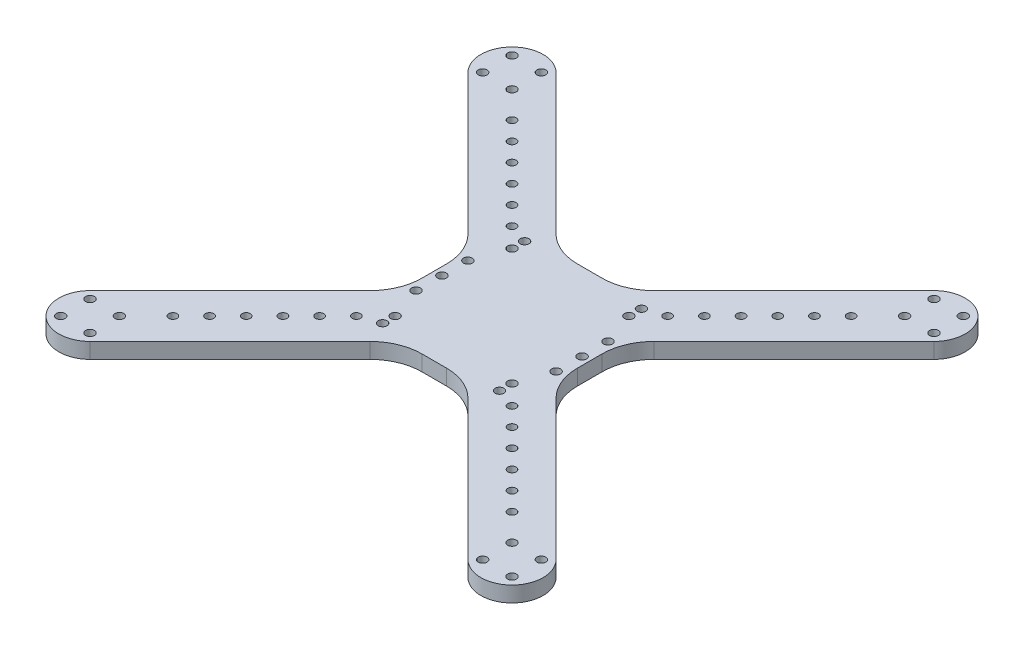
from build123d import *

# Parameters (mm, degrees)
BOSS_EXTRUDE1_DEPTH          = 6
FILLET1_R                    = 20
SKETCH2_R                    = 1.7
CUT_EXTRUDE1_DEPTH           = 133.106886392
CIRPATTERN1_COUNT            = 4
SKETCH3_R                    = 1.6
CUT_EXTRUDE2_DEPTH           = 133.106886392
LPATTERN1_COUNT              = 6
LPATTERN1_PITCH              = 10
CIRPATTERN2_COPY_1_SKETCH_R  = 1.6
CIRPATTERN2_COPY_1_DEPTH     = 133.106886392
CIRPATTERN2_COPY_2_SKETCH_R  = 1.6
CIRPATTERN2_COPY_2_DEPTH     = 133.106886392
CIRPATTERN2_COPY_3_SKETCH_R  = 1.6
CIRPATTERN2_COPY_3_DEPTH     = 133.106886392
CIRPATTERN2_COPY_4_SKETCH_R  = 1.6
CIRPATTERN2_COPY_4_DEPTH     = 133.106886392
CIRPATTERN2_COPY_5_SKETCH_R  = 1.6
CIRPATTERN2_COPY_5_DEPTH     = 133.106886392
CIRPATTERN2_COPY_6_SKETCH_R  = 1.6
CIRPATTERN2_COPY_6_DEPTH     = 133.106886392
CIRPATTERN2_COPY_7_SKETCH_R  = 1.6
CIRPATTERN2_COPY_7_DEPTH     = 133.106886392
CIRPATTERN2_COPY_8_SKETCH_R  = 1.6
CIRPATTERN2_COPY_8_DEPTH     = 133.106886392
CIRPATTERN2_COPY_9_SKETCH_R  = 1.6
CIRPATTERN2_COPY_9_DEPTH     = 133.106886392
CIRPATTERN2_COPY_10_SKETCH_R = 1.6
CIRPATTERN2_COPY_10_DEPTH    = 133.106886392
CIRPATTERN2_COPY_11_SKETCH_R = 1.6
CIRPATTERN2_COPY_11_DEPTH    = 133.106886392
CIRPATTERN2_COPY_12_SKETCH_R = 1.6
CIRPATTERN2_COPY_12_DEPTH    = 133.106886392
CIRPATTERN2_COPY_13_SKETCH_R = 1.6
CIRPATTERN2_COPY_13_DEPTH    = 133.106886392
CIRPATTERN2_COPY_14_SKETCH_R = 1.6
CIRPATTERN2_COPY_14_DEPTH    = 133.106886392
CIRPATTERN2_COPY_15_SKETCH_R = 1.6
CIRPATTERN2_COPY_15_DEPTH    = 133.106886392
CIRPATTERN2_COPY_16_SKETCH_R = 1.6
CIRPATTERN2_COPY_16_DEPTH    = 133.106886392
CIRPATTERN2_COPY_17_SKETCH_R = 1.6
CIRPATTERN2_COPY_17_DEPTH    = 133.106886392
CIRPATTERN2_COPY_18_SKETCH_R = 1.6
CIRPATTERN2_COPY_18_DEPTH    = 133.106886392
SKETCH4_R                    = 1.7
CUT_EXTRUDE3_DEPTH           = 133.106886392
CIRPATTERN3_COUNT            = 4
SKETCH5_R                    = 1.7
CUT_EXTRUDE4_DEPTH           = 133.106886392
SKETCH7_R                    = 1.7
CUT_EXTRUDE5_DEPTH           = 133.106886392
LPATTERN2_COUNT              = 2
LPATTERN2_PITCH              = 10
LPATTERN2_COUNT_DIR2         = 2
LPATTERN2_PITCH_DIR2         = 10
MIRROR2_COPY_1_SKETCH_R      = 1.7
MIRROR2_COPY_1_DEPTH         = 133.106886392
MIRROR2_COPY_2_SKETCH_R      = 1.7
MIRROR2_COPY_2_DEPTH         = 133.106886392
MIRROR2_COPY_3_SKETCH_R      = 1.7
MIRROR2_COPY_3_DEPTH         = 133.106886392
MIRROR2_COPY_4_SKETCH_R      = 1.7
MIRROR2_COPY_4_DEPTH         = 133.106886392


with BuildPart() as part:
    # Sketch1 → Boss-Extrude1 (new body)
    with BuildSketch(Plane(origin=(0, 0, 0), x_dir=(1, 0, 0), z_dir=(0, 1, 0))):
        with BuildLine():
            Line((-72.831998462, 89.802561211), (-13.029437252, 30))
            Line((-13.029437252, 30), (13.029437252, 30))
            Line((13.029437252, 30), (72.831998462, 89.802561211))
            ThreePointArc((72.831998462, 89.802561211), (89.802561211, 89.802561211), (89.802561211, 72.831998462))
            Line((89.802561211, 72.831998462), (30, 13.029437252))
            Line((30, 13.029437252), (30, -13.029437252))
            Line((30, -13.029437252), (89.802561211, -72.831998462))
            ThreePointArc((89.802561211, -72.831998462), (89.802561211, -89.802561211), (72.831998462, -89.802561211))
            Line((72.831998462, -89.802561211), (13.029437252, -30))
            Line((13.029437252, -30), (-13.029437252, -30))
            Line((-13.029437252, -30), (-72.831998462, -89.802561211))
            ThreePointArc((-72.831998462, -89.802561211), (-89.802561211, -89.802561211), (-89.802561211, -72.831998462))
            Line((-89.802561211, -72.831998462), (-30, -13.029437252))
            Line((-30, -13.029437252), (-30, 13.029437252))
            Line((-30, 13.029437252), (-89.802561211, 72.831998462))
            ThreePointArc((-89.802561211, 72.831998462), (-89.802561211, 89.802561211), (-72.831998462, 89.802561211))
        make_face()
    extrude(amount=BOSS_EXTRUDE1_DEPTH)

    # Fillet1
    fillet1_edges = [part.edges().sort_by_distance(p)[0] for p in [
        (-30, 3, -13.029437252),
        (-30, 3, 13.029437252),
        (-13.029437252, 3, -30),
        (13.029437252, 3, -30),
        (30, 3, 13.029437252),
        (30, 3, -13.029437252),
        (13.029437252, 3, 30),
        (-13.029437252, 3, 30),
    ]]
    fillet(fillet1_edges, radius=FILLET1_R)

    # Sketch2 → Cut-Extrude1 (cut, through all)
    with BuildSketch(Plane(origin=(0, 6, 0), x_dir=(1, 0, 0), z_dir=(0, 1, 0))):
        with Locations((-22.525, -22.525)):
            Circle(SKETCH2_R)
    cut_extrude1 = extrude(amount=-CUT_EXTRUDE1_DEPTH, mode=Mode.SUBTRACT)

    # CirPattern1: Cut-Extrude1 ×4 about axis
    cirpattern1_axis = Axis((0, 6.3, 0), (0, -1, 0))
    for i in range(1, CIRPATTERN1_COUNT):
        add(cut_extrude1.rotate(cirpattern1_axis, i * 360 / CIRPATTERN1_COUNT), mode=Mode.SUBTRACT)

    # Sketch3 → Cut-Extrude2 (cut, through all)
    with BuildSketch(Plane(origin=(0, 6, 0), x_dir=(1, 0, 0), z_dir=(0, 1, 0))):
        with Locations((-30, -30)):
            Circle(SKETCH3_R)
    cut_extrude2 = extrude(amount=-CUT_EXTRUDE2_DEPTH, mode=Mode.SUBTRACT)

    # LPattern1: Cut-Extrude2 ×6
    with Locations(*[Vector(-0.7071067811865466, 0, 0.7071067811865485) * (i * LPATTERN1_PITCH) for i in range(1, LPATTERN1_COUNT)]):
        add(cut_extrude2, mode=Mode.SUBTRACT)

    # CirPattern2 copy 1 sketch → CirPattern2 copy 1 (cut, through all)
    with BuildSketch(Plane(origin=(-7.071067812, 6, -7.071067812), x_dir=(0, 0, 1), z_dir=(0, 1, 0))):
        with Locations((-30, -30)):
            Circle(CIRPATTERN2_COPY_1_SKETCH_R)
    extrude(amount=-CIRPATTERN2_COPY_1_DEPTH, mode=Mode.SUBTRACT)

    # CirPattern2 copy 2 sketch → CirPattern2 copy 2 (cut, through all)
    with BuildSketch(Plane(origin=(7.071067812, 6, -7.071067812), x_dir=(-1, 0, 0), z_dir=(0, 1, 0))):
        with Locations((-30, -30)):
            Circle(CIRPATTERN2_COPY_2_SKETCH_R)
    extrude(amount=-CIRPATTERN2_COPY_2_DEPTH, mode=Mode.SUBTRACT)

    # CirPattern2 copy 3 sketch → CirPattern2 copy 3 (cut, through all)
    with BuildSketch(Plane(origin=(7.071067812, 6, 7.071067812), x_dir=(0, 0, -1), z_dir=(0, 1, 0))):
        with Locations((-30, -30)):
            Circle(CIRPATTERN2_COPY_3_SKETCH_R)
    extrude(amount=-CIRPATTERN2_COPY_3_DEPTH, mode=Mode.SUBTRACT)

    # CirPattern2 copy 4 sketch → CirPattern2 copy 4 (cut, through all)
    with BuildSketch(Plane(origin=(-14.142135624, 6, -14.142135624), x_dir=(0, 0, 1), z_dir=(0, 1, 0))):
        with Locations((-30, -30)):
            Circle(CIRPATTERN2_COPY_4_SKETCH_R)
    extrude(amount=-CIRPATTERN2_COPY_4_DEPTH, mode=Mode.SUBTRACT)

    # CirPattern2 copy 5 sketch → CirPattern2 copy 5 (cut, through all)
    with BuildSketch(Plane(origin=(14.142135624, 6, -14.142135624), x_dir=(-1, 0, 0), z_dir=(0, 1, 0))):
        with Locations((-30, -30)):
            Circle(CIRPATTERN2_COPY_5_SKETCH_R)
    extrude(amount=-CIRPATTERN2_COPY_5_DEPTH, mode=Mode.SUBTRACT)

    # CirPattern2 copy 6 sketch → CirPattern2 copy 6 (cut, through all)
    with BuildSketch(Plane(origin=(14.142135624, 6, 14.142135624), x_dir=(0, 0, -1), z_dir=(0, 1, 0))):
        with Locations((-30, -30)):
            Circle(CIRPATTERN2_COPY_6_SKETCH_R)
    extrude(amount=-CIRPATTERN2_COPY_6_DEPTH, mode=Mode.SUBTRACT)

    # CirPattern2 copy 7 sketch → CirPattern2 copy 7 (cut, through all)
    with BuildSketch(Plane(origin=(-21.213203436, 6, -21.213203436), x_dir=(0, 0, 1), z_dir=(0, 1, 0))):
        with Locations((-30, -30)):
            Circle(CIRPATTERN2_COPY_7_SKETCH_R)
    extrude(amount=-CIRPATTERN2_COPY_7_DEPTH, mode=Mode.SUBTRACT)

    # CirPattern2 copy 8 sketch → CirPattern2 copy 8 (cut, through all)
    with BuildSketch(Plane(origin=(21.213203436, 6, -21.213203436), x_dir=(-1, 0, 0), z_dir=(0, 1, 0))):
        with Locations((-30, -30)):
            Circle(CIRPATTERN2_COPY_8_SKETCH_R)
    extrude(amount=-CIRPATTERN2_COPY_8_DEPTH, mode=Mode.SUBTRACT)

    # CirPattern2 copy 9 sketch → CirPattern2 copy 9 (cut, through all)
    with BuildSketch(Plane(origin=(21.213203436, 6, 21.213203436), x_dir=(0, 0, -1), z_dir=(0, 1, 0))):
        with Locations((-30, -30)):
            Circle(CIRPATTERN2_COPY_9_SKETCH_R)
    extrude(amount=-CIRPATTERN2_COPY_9_DEPTH, mode=Mode.SUBTRACT)

    # CirPattern2 copy 10 sketch → CirPattern2 copy 10 (cut, through all)
    with BuildSketch(Plane(origin=(-28.284271247, 6, -28.284271247), x_dir=(0, 0, 1), z_dir=(0, 1, 0))):
        with Locations((-30, -30)):
            Circle(CIRPATTERN2_COPY_10_SKETCH_R)
    extrude(amount=-CIRPATTERN2_COPY_10_DEPTH, mode=Mode.SUBTRACT)

    # CirPattern2 copy 11 sketch → CirPattern2 copy 11 (cut, through all)
    with BuildSketch(Plane(origin=(28.284271247, 6, -28.284271247), x_dir=(-1, 0, 0), z_dir=(0, 1, 0))):
        with Locations((-30, -30)):
            Circle(CIRPATTERN2_COPY_11_SKETCH_R)
    extrude(amount=-CIRPATTERN2_COPY_11_DEPTH, mode=Mode.SUBTRACT)

    # CirPattern2 copy 12 sketch → CirPattern2 copy 12 (cut, through all)
    with BuildSketch(Plane(origin=(28.284271247, 6, 28.284271247), x_dir=(0, 0, -1), z_dir=(0, 1, 0))):
        with Locations((-30, -30)):
            Circle(CIRPATTERN2_COPY_12_SKETCH_R)
    extrude(amount=-CIRPATTERN2_COPY_12_DEPTH, mode=Mode.SUBTRACT)

    # CirPattern2 copy 13 sketch → CirPattern2 copy 13 (cut, through all)
    with BuildSketch(Plane(origin=(-35.355339059, 6, -35.355339059), x_dir=(0, 0, 1), z_dir=(0, 1, 0))):
        with Locations((-30, -30)):
            Circle(CIRPATTERN2_COPY_13_SKETCH_R)
    extrude(amount=-CIRPATTERN2_COPY_13_DEPTH, mode=Mode.SUBTRACT)

    # CirPattern2 copy 14 sketch → CirPattern2 copy 14 (cut, through all)
    with BuildSketch(Plane(origin=(35.355339059, 6, -35.355339059), x_dir=(-1, 0, 0), z_dir=(0, 1, 0))):
        with Locations((-30, -30)):
            Circle(CIRPATTERN2_COPY_14_SKETCH_R)
    extrude(amount=-CIRPATTERN2_COPY_14_DEPTH, mode=Mode.SUBTRACT)

    # CirPattern2 copy 15 sketch → CirPattern2 copy 15 (cut, through all)
    with BuildSketch(Plane(origin=(35.355339059, 6, 35.355339059), x_dir=(0, 0, -1), z_dir=(0, 1, 0))):
        with Locations((-30, -30)):
            Circle(CIRPATTERN2_COPY_15_SKETCH_R)
    extrude(amount=-CIRPATTERN2_COPY_15_DEPTH, mode=Mode.SUBTRACT)

    # CirPattern2 copy 16 sketch → CirPattern2 copy 16 (cut, through all)
    with BuildSketch(Plane.ZX.offset(6)):
        with Locations((-30, -30)):
            Circle(CIRPATTERN2_COPY_16_SKETCH_R)
    extrude(amount=-CIRPATTERN2_COPY_16_DEPTH, mode=Mode.SUBTRACT)

    # CirPattern2 copy 17 sketch → CirPattern2 copy 17 (cut, through all)
    with BuildSketch(Plane(origin=(0, 6, 0), x_dir=(-1, 0, 0), z_dir=(0, 1, 0))):
        with Locations((-30, -30)):
            Circle(CIRPATTERN2_COPY_17_SKETCH_R)
    extrude(amount=-CIRPATTERN2_COPY_17_DEPTH, mode=Mode.SUBTRACT)

    # CirPattern2 copy 18 sketch → CirPattern2 copy 18 (cut, through all)
    with BuildSketch(Plane(origin=(0, 6, 0), x_dir=(0, 0, -1), z_dir=(0, 1, 0))):
        with Locations((-30, -30)):
            Circle(CIRPATTERN2_COPY_18_SKETCH_R)
    extrude(amount=-CIRPATTERN2_COPY_18_DEPTH, mode=Mode.SUBTRACT)

    # Sketch4 → Cut-Extrude3 (cut, through all)
    with BuildSketch(Plane(origin=(0, 6, 0), x_dir=(1, 0, 0), z_dir=(0, 1, 0))):
        with Locations((-75.660425587, -75.660425587)):
            Circle(SKETCH4_R)
        with Locations((-75.660425587, -86.974134086)):
            Circle(SKETCH4_R)
        with Locations((-86.974134086, -75.660425587)):
            Circle(SKETCH4_R)
        with Locations((-86.974134086, -86.974134086)):
            Circle(SKETCH4_R)
    cut_extrude3 = extrude(amount=-CUT_EXTRUDE3_DEPTH, mode=Mode.SUBTRACT)

    # CirPattern3: Cut-Extrude3 ×4 about axis
    cirpattern3_axis = Axis((0, 6.3, 0), (0, -1, 0))
    for i in range(1, CIRPATTERN3_COUNT):
        add(cut_extrude3.rotate(cirpattern3_axis, i * 360 / CIRPATTERN3_COUNT), mode=Mode.SUBTRACT)

    # Sketch5 → Cut-Extrude4 (cut, through all)
    with BuildSketch(Plane(origin=(0, 6, 0), x_dir=(1, 0, 0), z_dir=(0, 1, 0))):
        with Locations((-22.525, 27.375)):
            Circle(SKETCH5_R)
        with Locations((-22.525, -27.35)):
            Circle(SKETCH5_R)
    cut_extrude4 = extrude(amount=-CUT_EXTRUDE4_DEPTH, mode=Mode.SUBTRACT)

    # Mirror1: Cut-Extrude4 across plane
    add(cut_extrude4.mirror(Plane(origin=(0, 0, 0), x_dir=(0, 0, 1), z_dir=(1, 0, 0))), mode=Mode.SUBTRACT)

    # Sketch7 → Cut-Extrude5 (cut, through all)
    with BuildSketch(Plane(origin=(0, 6, 0), x_dir=(1, 0, 0), z_dir=(0, 1, 0))):
        with Locations((-27, 0)):
            Circle(SKETCH7_R)
    cut_extrude5 = extrude(amount=-CUT_EXTRUDE5_DEPTH, mode=Mode.SUBTRACT)

    # LPattern2: Cut-Extrude5 2 × 2
    with Locations(*[Vector(0, 0, 1) * (i * LPATTERN2_PITCH) + Vector(0, 0, -1) * (j * LPATTERN2_PITCH_DIR2) for i in range(LPATTERN2_COUNT) for j in range(LPATTERN2_COUNT_DIR2) if (i, j) != (0, 0)]):
        add(cut_extrude5, mode=Mode.SUBTRACT)

    # Mirror2 copy 1 sketch → Mirror2 copy 1 (cut, through all)
    with BuildSketch(Plane(origin=(0, 6, -10), x_dir=(-1, 0, 0), z_dir=(0, 1, 0))):
        with Locations((-27, 0)):
            Circle(MIRROR2_COPY_1_SKETCH_R)
    extrude(amount=-MIRROR2_COPY_1_DEPTH, mode=Mode.SUBTRACT)

    # Mirror2 copy 2 sketch → Mirror2 copy 2 (cut, through all)
    with BuildSketch(Plane(origin=(0, 6, 10), x_dir=(-1, 0, 0), z_dir=(0, 1, 0))):
        with Locations((-27, 0)):
            Circle(MIRROR2_COPY_2_SKETCH_R)
    extrude(amount=-MIRROR2_COPY_2_DEPTH, mode=Mode.SUBTRACT)

    # Mirror2 copy 3 sketch → Mirror2 copy 3 (cut, through all)
    with BuildSketch(Plane(origin=(0, 6, 0), x_dir=(-1, 0, 0), z_dir=(0, 1, 0))):
        with Locations((-27, 0)):
            Circle(MIRROR2_COPY_3_SKETCH_R)
    extrude(amount=-MIRROR2_COPY_3_DEPTH, mode=Mode.SUBTRACT)

    # Mirror2 copy 4 sketch → Mirror2 copy 4 (cut, through all)
    with BuildSketch(Plane(origin=(0, 6, 0), x_dir=(-1, 0, 0), z_dir=(0, 1, 0))):
        with Locations((-27, 0)):
            Circle(MIRROR2_COPY_4_SKETCH_R)
    extrude(amount=-MIRROR2_COPY_4_DEPTH, mode=Mode.SUBTRACT)


solid = part.part
